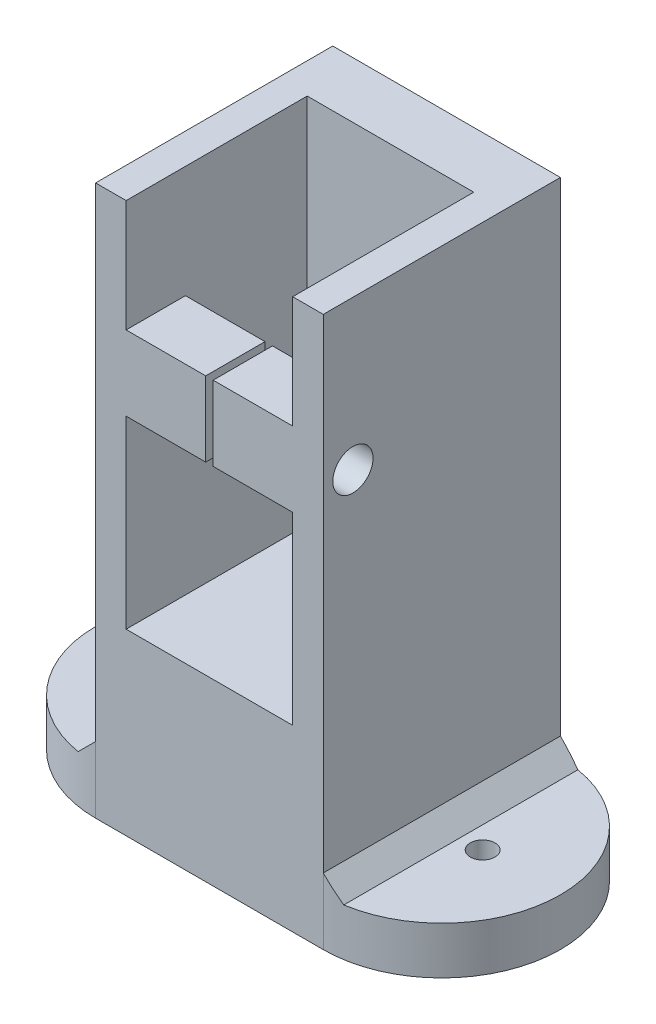
from build123d import *

# Parameters (mm, degrees)
SKETCH1_R               = 1.651
BOSS_EXTRUDE1_DEPTH     = 6.35
BOSS_EXTRUDE1_2_DEPTH   = 6.35
SKETCH1_3_W             = 30.48
SKETCH1_3_H             = 31.75
BOSS_EXTRUDE2_DEPTH     = 73.66
SKETCH2_W               = 22.3
SKETCH2_H               = 49.699999914
CUT_EXTRUDE1_DEPTH      = 24.240000034
SKETCH3_R               = 2.99085
CUT_EXTRUDE2_DEPTH      = 10.16
CHAMFER1_SIZE           = 2.54
SKETCH4_W               = 7.940000122
SKETCH4_H               = 10
BOSS_EXTRUDE3_DEPTH     = 10.65
CUT_EXTRUDE3_DEPTH      = 87.216972372
CUT_EXTRUDE3_DEPTH_BACK = 87.716972372
CUT_EXTRUDE3_START      = 0.5
SKETCH6_R               = 2.694750008


with BuildPart() as part:
    # Sketch1 → Boss-Extrude1 (new body)
    with BuildSketch(Plane(origin=(0, 0, 0), x_dir=(1, 0, 0), z_dir=(0, 1, 0))):
        with BuildLine():
            ThreePointArc((0, 0), (-15.875, 15.875), (0, 31.75))
            Line((0, 31.75), (0, 0))
        make_face()
        with Locations(Location((-5.461, 15.875, 0), (0, 0, 270))):
            Circle(SKETCH1_R, mode=Mode.SUBTRACT)
    extrude(amount=BOSS_EXTRUDE1_DEPTH)



with BuildPart() as body_2:
    # Sketch1 → Boss-Extrude1 2 (new body)
    with BuildSketch(Plane(origin=(0, 0, 0), x_dir=(1, 0, 0), z_dir=(0, 1, 0))):
        with BuildLine():
            Line((30.48, 0), (30.48, 31.75))
            ThreePointArc((30.48, 31.75), (46.355, 15.875), (30.48, 0))
        make_face()
        with Locations(Location((35.941, 15.875, 0), (0, 0, 270))):
            Circle(SKETCH1_R, mode=Mode.SUBTRACT)
    extrude(amount=BOSS_EXTRUDE1_2_DEPTH)


with BuildPart() as part_1:
    add(part.part)

    add(body_2.part)  # Boss-Extrude2 merges body 2
    # Sketch1<3> → Boss-Extrude2 (add)
    with BuildSketch(Plane(origin=(0, 0, 0), x_dir=(1, 0, 0), z_dir=(0, 1, 0))):
        with Locations((15.24, 15.875)):
            Rectangle(SKETCH1_3_W, SKETCH1_3_H)
    extrude(amount=BOSS_EXTRUDE2_DEPTH)

    # Sketch2 → Cut-Extrude1 (cut)
    with BuildSketch(Plane.XY):
        with Locations((15.24, 48.810000043)):
            Rectangle(SKETCH2_W, SKETCH2_H)
    extrude(amount=-CUT_EXTRUDE1_DEPTH, mode=Mode.SUBTRACT)

    # Sketch3 → Cut-Extrude2 (cut)
    with BuildSketch(Plane.XY.offset(-24.240000034)):
        with Locations((15.24, 28.370000086)):
            Circle(SKETCH3_R)
    extrude(amount=-CUT_EXTRUDE2_DEPTH, mode=Mode.SUBTRACT)

    # Chamfer1
    # the kernel refuses this chamfer: 2.54 mm, written as the material it adds along each edge
    with BuildSketch(Plane(origin=(0, 6.35, -38.282074789), x_dir=(-0.9996219169112966, -0.02749587661058626, 0), z_dir=(0, 0, 1))) as chamfer1_piece_1_section:
        Polygon((CHAMFER1_SIZE * 0.999621916911, -CHAMFER1_SIZE * 0.0274958766106), (-CHAMFER1_SIZE * 0.0274958766106, -CHAMFER1_SIZE * 0.999621916911), (0, 0), align=None)
    chamfer1_piece_1 = extrude(amount=44.814149579, mode=Mode.PRIVATE)
    chamfer1_piece_1 = chamfer1_piece_1 & Plane(origin=(0, 7.197393373, -15.875), x_dir=(0, 0, 1), z_dir=(0, -1, 0)) * Cylinder(15.875, 100, mode=Mode.PRIVATE)
    add(chamfer1_piece_1)
    with BuildSketch(Plane(origin=(30.48, 6.35, 6.532074789), x_dir=(-0.02749587661058591, 0.9996219169112968, 0), z_dir=(0, 0, -1))) as chamfer1_piece_2_section:
        Polygon((CHAMFER1_SIZE * 0.999621916911, CHAMFER1_SIZE * 0.0274958766106), (-CHAMFER1_SIZE * 0.0274958766106, CHAMFER1_SIZE * 0.999621916911), (0, 0), align=None)
    chamfer1_piece_2 = extrude(amount=44.814149579, mode=Mode.PRIVATE)
    chamfer1_piece_2 = chamfer1_piece_2 & Plane(origin=(30.48, 7.197393373, -15.875), x_dir=(0, 0, -1), z_dir=(0, -1, 0)) * Cylinder(15.875, 100, mode=Mode.PRIVATE)
    add(chamfer1_piece_2)

    # Sketch4 → Boss-Extrude3 (add)
    with BuildSketch(Plane(origin=(4.09, 0, 0), x_dir=(0, 0, -1), z_dir=(1, 0, 0))):
        with Locations((3.970000061, 53.66)):
            Rectangle(SKETCH4_W, SKETCH4_H)
    boss_extrude3 = extrude(amount=BOSS_EXTRUDE3_DEPTH)

    # Mirror1: Boss-Extrude3 across plane
    add(boss_extrude3.mirror(Plane(origin=(15.24, 0, 0), x_dir=(0, 0, 1), z_dir=(1, 0, 0))))

    # Sketch6 → Cut-Extrude3 (cut, two sides: drawn at the far end of the back side and taken through both)
    with BuildSketch(Plane(origin=(14.74, 0, 0), x_dir=(0, 0, -1), z_dir=(1, 0, 0)).offset(CUT_EXTRUDE3_START - CUT_EXTRUDE3_DEPTH_BACK)):
        with Locations(Location((3.970000061, 53.66, 0), (0, 0, 90))):
            Circle(SKETCH6_R)
    extrude(amount=CUT_EXTRUDE3_DEPTH + CUT_EXTRUDE3_DEPTH_BACK, mode=Mode.SUBTRACT)


solid = part_1.part
